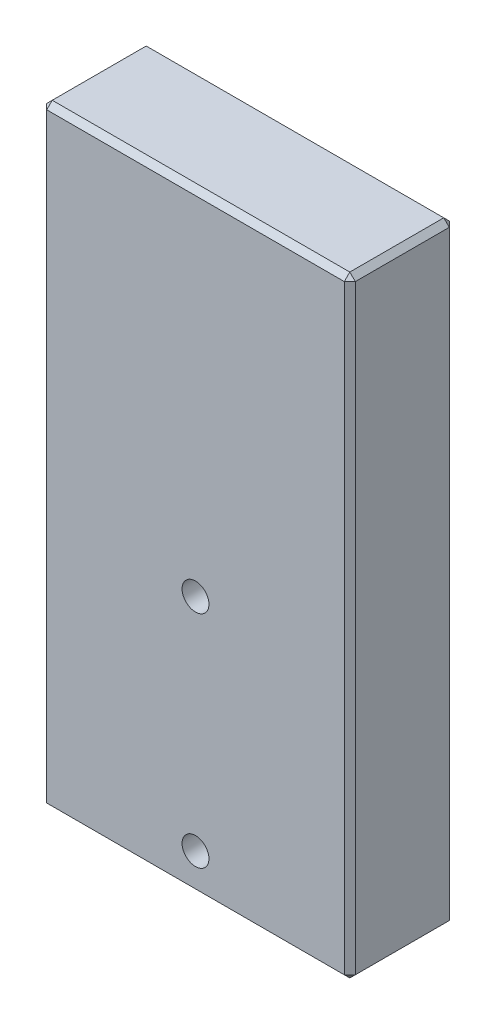
from build123d import *

# Parameters (mm, degrees)
SKETCH1_W           = 28
SKETCH1_H           = 55.475
BOSS_EXTRUDE1_DEPTH = 9.525
SKETCH2_R           = 1.2195
CUT_EXTRUDE1_DEPTH  = 20
SKETCH3_R           = 1.2195
CUT_EXTRUDE2_DEPTH  = 63.866535215
CHAMFER1_SIZE       = 0.5


with BuildPart() as part:
    # Sketch1 → Boss-Extrude1 (new body)
    with BuildSketch(Plane.XY):
        with Locations((14, 27.7375)):
            Rectangle(SKETCH1_W, SKETCH1_H)
    extrude(amount=BOSS_EXTRUDE1_DEPTH)

    # Sketch2 → Cut-Extrude1 (cut)
    with BuildSketch(Plane.XZ):
        with Locations((5, 4.7625)):
            Circle(SKETCH2_R)
        with Locations((23, 4.7625)):
            Circle(SKETCH2_R)
    extrude(amount=-CUT_EXTRUDE1_DEPTH, mode=Mode.SUBTRACT)

    # Sketch3 → Cut-Extrude2 (cut, through all)
    with BuildSketch(Plane.XY.offset(9.525)):
        with Locations((14, 3.475)):
            Circle(SKETCH3_R)
        with Locations((14, 23.475)):
            Circle(SKETCH3_R)
    extrude(amount=-CUT_EXTRUDE2_DEPTH, mode=Mode.SUBTRACT)

    # Chamfer1
    chamfer1_edges = [part.edges().sort_by_distance(p)[0] for p in [
        (14, 0, 0),
        (28, 0, 4.7625),
        (28, 27.7375, 0),
        (14, 55.475, 0),
        (28, 55.475, 4.7625),
        (28, 27.7375, 9.525),
        (14, 55.475, 9.525),
        (14, 0, 9.525),
        (0, 0, 4.7625),
        (0, 27.7375, 0),
        (0, 55.475, 4.7625),
        (0, 27.7375, 9.525),
    ]]
    chamfer(chamfer1_edges, length=CHAMFER1_SIZE)


solid = part.part
